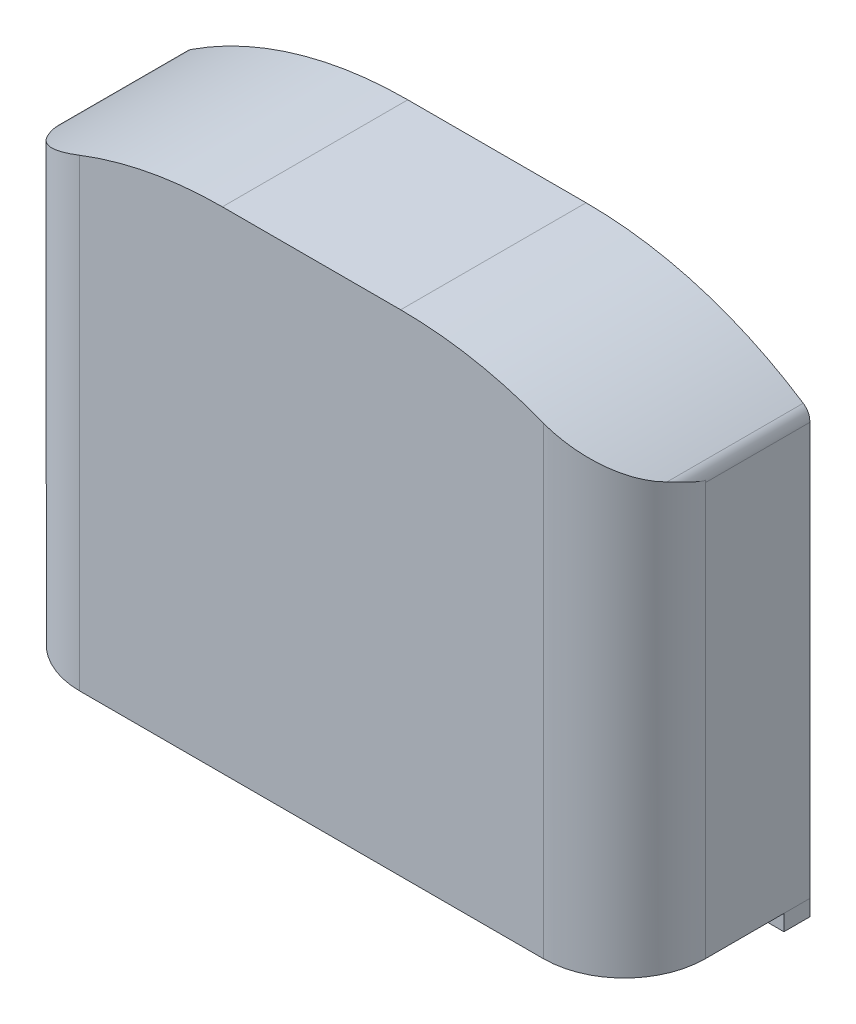
from build123d import *
from build123d.topology import SkipClean

# Parameters (mm, degrees)
SKETCH1_R              = 1.25
BOSS_EXTRUDE1_DEPTH    = 5
SKETCH1_3_R            = 2
SKETCH1_3_R_2          = 1.25
BOSS_EXTRUDE2_DEPTH    = 9
DRAFT2_ANGLE           = 1
DRAFT3_ANGLE           = 10
DRAFT4_ANGLE           = 10
DRAFT5_ANGLE           = 10
DRAFT6_ANGLE           = 10
BOSS_EXTRUDE3_START    = -47
BOSS_EXTRUDE3_DEPTH    = 65
BOSS_EXTRUDE4_DEPTH    = 18
CUT_EXTRUDE1_START     = -4
CUT_EXTRUDE1_OUTLINE_R = 1.25
CUT_EXTRUDE1_DEPTH     = 4
BOSS_EXTRUDE5_START    = -61.5
SKETCH4_3_R            = 2
SKETCH4_3_R_2          = 1.25
BOSS_EXTRUDE5_DEPTH    = 3
DRAFT7_ANGLE           = 10
BOSS_EXTRUDE6_START    = -129.207717715
BOSS_EXTRUDE6_DEPTH    = 129.207717715
BOSS_EXTRUDE7_DEPTH    = 5
BOSS_EXTRUDE8_START    = -8.1
BOSS_EXTRUDE8_DEPTH    = 8.1
BOSS_EXTRUDE9_DEPTH    = 56
CUT_EXTRUDE2_DEPTH     = 56
BOSS_EXTRUDE10_REACH   = 977.486
BOSS_EXTRUDE11_START   = 3.1
SKETCH15_R             = 1.25
BOSS_EXTRUDE11_DEPTH   = 3.1
SKETCH16_W             = 46.582234477
SKETCH16_H             = 8.626339718
BOSS_EXTRUDE12_DEPTH   = 11
CUT_EXTRUDE3_DEPTH     = 23
BOSS_EXTRUDE13_REACH   = 977.486
CUT_EXTRUDE4_START     = 902.404614716
CUT_EXTRUDE4_DEPTH     = 3
SKETCH20_R             = 10.068355609
CUT_EXTRUDE5_DEPTH     = 8.1


# Read off the part's stored shape, not the designer's step: Cut-Extrude1, Boss-Extrude6, Cut-Extrude4
with BuildPart() as part:
    # Sketch1 → Boss-Extrude1 (new body)
    with BuildSketch(Plane.XY.offset(905.504614716)):
        with BuildLine():
            Line((21.161363812, 82.735268637), (-34.714540797, 82.735268637))
            ThreePointArc((-34.714540797, 82.735268637), (-68.804835079, 77.739415811), (-100.028178471, 63.172002275))
            Line((-100.028178471, 63.172002275), (-100.028178471, -66.035715441))
            Line((-100.028178471, -66.035715441), (86.475001486, -66.035715441))
            Line((86.475001486, -66.035715441), (86.475001486, 63.172002275))
            ThreePointArc((86.475001486, 63.172002275), (55.251658094, 77.739415811), (21.161363812, 82.735268637))
        make_face()
        with Locations((-65.145436721, 57.131533665)):
            Circle(SKETCH1_R, mode=Mode.SUBTRACT)
        with Locations((-7.145436721, 57.131533665)):
            Circle(SKETCH1_R, mode=Mode.SUBTRACT)
        with Locations((-7.145436721, 8.131533665)):
            Circle(SKETCH1_R, mode=Mode.SUBTRACT)
        with Locations((-65.145436721, 8.131533665)):
            Circle(SKETCH1_R, mode=Mode.SUBTRACT)
    extrude(amount=BOSS_EXTRUDE1_DEPTH)

    # Sketch1<3> → Boss-Extrude2 (add)
    # profile 1 of 4: a face of its own
    with BuildSketch(Plane.XY.offset(905.504614716)):
        with Locations((-65.145436721, 57.131533665)):
            Circle(SKETCH1_3_R)
        with Locations((-65.145436721, 57.131533665)):
            Circle(SKETCH1_3_R_2, mode=Mode.SUBTRACT)
    # profile 2 of 4: a face of its own
    with BuildSketch(Plane.XY.offset(905.504614716)):
        with Locations((-7.145436721, 57.131533665)):
            Circle(SKETCH1_3_R)
        with Locations((-7.145436721, 57.131533665)):
            Circle(SKETCH1_3_R_2, mode=Mode.SUBTRACT)
    # profile 3 of 4: a face of its own
    with BuildSketch(Plane.XY.offset(905.504614716)):
        with Locations((-7.145436721, 8.131533665)):
            Circle(SKETCH1_3_R)
        with Locations((-7.145436721, 8.131533665)):
            Circle(SKETCH1_3_R_2, mode=Mode.SUBTRACT)
    # profile 4 of 4: a face of its own
    with BuildSketch(Plane.XY.offset(905.504614716)):
        with Locations((-65.145436721, 8.131533665)):
            Circle(SKETCH1_3_R)
        with Locations((-65.145436721, 8.131533665)):
            Circle(SKETCH1_3_R_2, mode=Mode.SUBTRACT)
    extrude(amount=BOSS_EXTRUDE2_DEPTH)

    # Draft2
    draft2_faces = [part.faces().sort_by_distance(p)[0] for p in [
        (-9.145436721, 57.131533665, 912.504614716),
    ]]
    draft(draft2_faces, Plane.XY.offset(914.504614716), DRAFT2_ANGLE)

    # Draft3
    draft3_faces = [part.faces().sort_by_distance(p)[0] for p in [
        (-9.180346851, 57.131533665, 912.504614716),
    ]]
    draft(draft3_faces, Plane.XY.offset(914.504614716), DRAFT3_ANGLE)

    # Draft4
    draft4_faces = [part.faces().sort_by_distance(p)[0] for p in [
        (-9.145436721, 8.131533665, 912.504614716),
    ]]
    draft(draft4_faces, Plane.XY.offset(914.504614716), DRAFT4_ANGLE)

    # Draft5
    draft5_faces = [part.faces().sort_by_distance(p)[0] for p in [
        (-67.145436721, 8.131533665, 912.504614716),
    ]]
    draft(draft5_faces, Plane.XY.offset(914.504614716), DRAFT5_ANGLE)

    # Draft6
    draft6_faces = [part.faces().sort_by_distance(p)[0] for p in [
        (-67.145436721, 57.131533665, 912.504614716),
    ]]
    draft(draft6_faces, Plane.XY.offset(914.504614716), DRAFT6_ANGLE)

    # Sketch2 → Boss-Extrude3 (add)
    with BuildSketch(Plane.ZY.offset(57.488178471).offset(BOSS_EXTRUDE3_START)):
        with BuildLine():
            Line((910.504614716, 1.031533665), (910.504614716, -3.968466335))
            Line((910.504614716, -3.968466335), (949.004614716, -3.968466335))
            Line((949.004614716, -3.968466335), (949.004614716, -52.468466335))
            Line((949.004614716, -52.468466335), (910.504614716, -52.468466335))
            Line((910.504614716, -52.468466335), (910.504614716, -57.468466335))
            Line((910.504614716, -57.468466335), (949.004614716, -57.468466335))
            ThreePointArc((949.004614716, -57.468466335), (952.540148622, -56.004000241), (954.004614716, -52.468466335))
            Line((954.004614716, -52.468466335), (954.004614716, 1.031533665))
            Line((954.004614716, 1.031533665), (910.504614716, 1.031533665))
        make_face()
    boss_extrude3 = extrude(amount=BOSS_EXTRUDE3_DEPTH)

    # Mirror1: Boss-Extrude3 across plane
    add(boss_extrude3.mirror(Plane.ZY.offset(6.776588492)))

    # Sketch3 → Boss-Extrude4 (add)
    with BuildSketch(Plane(origin=(61.935001486, 0, 0), x_dir=(0, 0, -1), z_dir=(1, 0, 0))):
        with BuildLine():
            Line((-948.618181428, 8.159490613), (-948.618181428, 1.031533665))
            Line((-948.618181428, 1.031533665), (-945.118181428, 1.031533665))
            Line((-945.118181428, 1.031533665), (-945.118181428, 6.659490613))
            Line((-945.118181428, 6.659490613), (-932.117085954, 6.659490613))
            Line((-932.117085954, 6.659490613), (-932.117085954, 4.976311178))
            Line((-932.117085954, 4.976311178), (-929.820703495, 4.976311178))
            Line((-929.820703495, 4.976311178), (-929.820703495, 6.659490613))
            Line((-929.820703495, 6.659490613), (-929.820703495, 10.159490613))
            Line((-929.820703495, 10.159490613), (-946.618181428, 10.159490613))
            ThreePointArc((-946.618181428, 10.159490613), (-948.032394991, 9.573704175), (-948.618181428, 8.159490613))
        make_face()
    extrude(amount=-BOSS_EXTRUDE4_DEPTH)

    # Cut-Extrude1 outline → Cut-Extrude1 (cut)
    with BuildSketch(Plane.XZ.offset(57.468466335).offset(CUT_EXTRUDE1_START)):
        with BuildLine():
            Line((-70.665918987, 949.004614716), (-68.166437954, 949.004614716))
            ThreePointArc((-68.166437954, 949.004614716), (-69.416178471, 950.280083156), (-70.665918987, 949.004614716))
        make_face()
        with BuildLine():
            Line((-14.785918987, 949.004614716), (-12.286437954, 949.004614716))
            ThreePointArc((-12.286437954, 949.004614716), (-13.536178471, 950.280083156), (-14.785918987, 949.004614716))
        make_face()
        with Locations((-69.416178471, 929.980083156)):
            Circle(CUT_EXTRUDE1_OUTLINE_R)
        with Locations((-13.536178471, 929.980083156)):
            Circle(CUT_EXTRUDE1_OUTLINE_R)
    extrude(amount=CUT_EXTRUDE1_DEPTH, mode=Mode.SUBTRACT)

    # Sketch4<3> → Boss-Extrude5 (add)
    # profile 1 of 4: a face of its own
    with BuildSketch(Plane.XZ.offset(57.468466335).offset(BOSS_EXTRUDE5_START)):
        with Locations((-69.416178471, 949.030083156)):
            Circle(SKETCH4_3_R)
        with Locations((-69.416178471, 949.030083156)):
            Circle(SKETCH4_3_R_2, mode=Mode.SUBTRACT)
    # profile 2 of 4: a face of its own
    with BuildSketch(Plane.XZ.offset(57.468466335).offset(BOSS_EXTRUDE5_START)):
        with Locations((-69.416178471, 929.980083156)):
            Circle(SKETCH4_3_R)
        with Locations((-69.416178471, 929.980083156)):
            Circle(SKETCH4_3_R_2, mode=Mode.SUBTRACT)
    # profile 3 of 4: a face of its own
    with BuildSketch(Plane.XZ.offset(57.468466335).offset(BOSS_EXTRUDE5_START)):
        with Locations((-13.536178471, 929.980083156)):
            Circle(SKETCH4_3_R)
        with Locations((-13.536178471, 929.980083156)):
            Circle(SKETCH4_3_R_2, mode=Mode.SUBTRACT)
    # profile 4 of 4: a face of its own
    with BuildSketch(Plane.XZ.offset(57.468466335).offset(BOSS_EXTRUDE5_START)):
        with Locations((-13.536178471, 949.030083156)):
            Circle(SKETCH4_3_R)
        with Locations((-13.536178471, 949.030083156)):
            Circle(SKETCH4_3_R_2, mode=Mode.SUBTRACT)
    extrude(amount=BOSS_EXTRUDE5_DEPTH)

    # Draft7
    draft7_faces = [part.faces().sort_by_distance(p)[0] for p in [
        (-71.416178471, 2.531533665, 929.980083156),
        (-15.536178471, 2.531533665, 929.980083156),
        (-15.536178471, 2.531533665, 949.030083156),
        (-71.416178471, 2.531533665, 949.030083156),
    ]]
    draft(draft7_faces, Plane(origin=(-69.416178471, 4.031533665, 949.030083156), x_dir=(1, 0, 0), z_dir=(0, 1, 0)), DRAFT7_ANGLE)

    # Sketch6 → Boss-Extrude7 (add)
    with BuildSketch(Plane.XZ.offset(66.035715441)):
        Polygon((-100.028178471, 910.504614716), (-104.828178471, 910.504614716), (-104.828178471, 902.404614716), (91.275001486, 902.404614716), (91.275001486, 910.504614716), align=None)
    extrude(amount=BOSS_EXTRUDE7_DEPTH)

    # Sketch15 → Boss-Extrude11 (add)
    with SkipClean():  # the faces are left unmerged after this step: merging them gives an invalid solid
        with BuildSketch(Plane(origin=(0, 0, 905.504614716), x_dir=(-1, 0, 0), z_dir=(0, 0, -1)).offset(BOSS_EXTRUDE11_START)):
            with BuildLine():
                Line((-83.275001486, 65.205496764), (-83.275001486, 63.172002275))
                Line((-83.275001486, 63.172002275), (-83.275001486, -66.035715441))
                Line((-83.275001486, -66.035715441), (96.828178471, -66.035715441))
                Line((96.828178471, -66.035715441), (96.828178471, 63.172002275))
                Line((96.828178471, 63.172002275), (96.828178471, 65.205496764))
                ThreePointArc((96.828178471, 65.205496764), (66.984483805, 78.26887305), (34.714540797, 82.735268637))
                Line((34.714540797, 82.735268637), (-21.161363812, 82.735268637))
                ThreePointArc((-21.161363812, 82.735268637), (-53.43130682, 78.26887305), (-83.275001486, 65.205496764))
            make_face()
            with Locations((7.145436721, 8.131533665)):
                Circle(SKETCH15_R, mode=Mode.SUBTRACT)
            with Locations((65.145436721, 8.131533665)):
                Circle(SKETCH15_R, mode=Mode.SUBTRACT)
            with Locations((7.145436721, 57.131533665)):
                Circle(SKETCH15_R, mode=Mode.SUBTRACT)
            with Locations((65.145436721, 57.131533665)):
                Circle(SKETCH15_R, mode=Mode.SUBTRACT)
        extrude(amount=-BOSS_EXTRUDE11_DEPTH)

    # Sketch16 → Boss-Extrude12 (add)
    with SkipClean():  # the faces are left unmerged after this step: merging them gives an invalid solid
        with BuildSketch(Plane(origin=(0, 0, 902.404614716), x_dir=(-1, 0, 0), z_dir=(0, 0, -1))):
            with Locations((6.776588493, 36.174406639)):
                Rectangle(SKETCH16_W, SKETCH16_H)
        extrude(amount=BOSS_EXTRUDE12_DEPTH)

    # Sketch17 → Cut-Extrude3 (cut)
    with SkipClean():  # the faces are left unmerged after this step: merging them gives an invalid solid
        with BuildSketch(Plane(origin=(0, 40.487576498, 0), x_dir=(1, 0, 0), z_dir=(0, 1, 0))):
            with BuildLine():
                Line((-20.276588492, -894.404614716), (6.723411508, -894.404614716))
                ThreePointArc((6.723411508, -894.404614716), (8.973411508, -896.654614716), (6.723411508, -898.904614716))
                Line((6.723411508, -898.904614716), (-20.276588492, -898.904614716))
                ThreePointArc((-20.276588492, -898.904614716), (-22.526588492, -896.654614716), (-20.276588492, -894.404614716))
            make_face()
        extrude(amount=-CUT_EXTRUDE3_DEPTH, mode=Mode.SUBTRACT)

    # Cut-Extrude4 outline → Cut-Extrude4 (cut)
    with SkipClean():  # the faces are left unmerged after this step: merging them gives an invalid solid
        with BuildSketch(Plane.XY.offset(CUT_EXTRUDE4_START)):
            with BuildLine():
                ThreePointArc((83.275001486, 65.205496765), (83.02518939, 65.358280617), (82.775001486, 65.510448293))
                Line((82.775001486, 65.510448293), (82.775001486, -66.035715441))
                Line((82.775001486, -66.035715441), (83.275001486, -66.035715441))
                Line((83.275001486, -66.035715441), (83.275001486, 65.205496765))
            make_face()
            with BuildLine():
                Line((-96.828178471, -66.035715441), (-96.328178471, -66.035715441))
                Line((-96.328178471, -66.035715441), (-96.328178471, 65.510448293))
                ThreePointArc((-96.328178471, 65.510448293), (-96.578366375, 65.358280617), (-96.828178471, 65.205496765))
                Line((-96.828178471, 65.205496765), (-96.828178471, -66.035715441))
            make_face()
        extrude(amount=CUT_EXTRUDE4_DEPTH, mode=Mode.SUBTRACT)

    # Sketch20 → Cut-Extrude5 (cut)
    with BuildSketch(Plane(origin=(0, 0, 902.404614716), x_dir=(-1, 0, 0), z_dir=(0, 0, -1))):
        with Locations((-66.306295987, 50.017245785)):
            Circle(SKETCH20_R)
    extrude(amount=-CUT_EXTRUDE5_DEPTH, mode=Mode.SUBTRACT)


with BuildPart() as body_2:
    # Boss-Extrude6 outline → Boss-Extrude6 (new body)
    with BuildSketch(Plane.XZ.offset(66.035715441).offset(BOSS_EXTRUDE6_START)):
        with BuildLine():
            Line((91.275001486, 902.404614716), (91.275001486, 935.145243266))
            ThreePointArc((91.275001486, 935.145243266), (83.847413555, 953.077026785), (65.915630036, 960.504614716))
            Line((65.915630036, 960.504614716), (-79.468807021, 960.504614716))
            ThreePointArc((-79.468807021, 960.504614716), (-97.40059054, 953.077026785), (-104.828178471, 935.145243266))
            Line((-104.828178471, 935.145243266), (-104.828178471, 902.404614716))
            Line((-104.828178471, 902.404614716), (-96.828178471, 902.404614716))
            Line((-96.828178471, 902.404614716), (-96.828178471, 905.404614716))
            Line((-96.828178471, 905.404614716), (-99.828178471, 905.404614716))
            Line((-99.828178471, 905.404614716), (-99.828178471, 905.504614716))
            Line((-99.828178471, 905.504614716), (-100.028178471, 905.504614716))
            Line((-100.028178471, 905.504614716), (-100.028178471, 910.504614716))
            Line((-100.028178471, 910.504614716), (-99.828178471, 910.504614716))
            Line((-99.828178471, 910.504614716), (-99.828178471, 910.604614716))
            Line((-99.828178471, 910.604614716), (-96.828178471, 910.604614716))
            Line((-96.828178471, 910.604614716), (-96.828178471, 925.760622686))
            Line((-96.828178471, 925.760622686), (-99.828178471, 925.760622686))
            Line((-99.828178471, 925.760622686), (-99.828178471, 935.145243266))
            ThreePointArc((-99.828178471, 935.145243266), (-93.865056634, 949.541492879), (-79.468807021, 955.504614716))
            Line((-79.468807021, 955.504614716), (65.915630036, 955.504614716))
            ThreePointArc((65.915630036, 955.504614716), (80.311879649, 949.541492879), (86.275001486, 935.145243266))
            Line((86.275001486, 935.145243266), (86.275001486, 925.760622686))
            Line((86.275001486, 925.760622686), (83.275001486, 925.760622686))
            Line((83.275001486, 925.760622686), (83.275001486, 910.604614716))
            Line((83.275001486, 910.604614716), (86.275001486, 910.604614716))
            Line((86.275001486, 910.604614716), (86.275001486, 910.504614716))
            Line((86.275001486, 910.504614716), (86.475001486, 910.504614716))
            Line((86.475001486, 910.504614716), (86.475001486, 905.504614716))
            Line((86.475001486, 905.504614716), (86.275001486, 905.504614716))
            Line((86.275001486, 905.504614716), (86.275001486, 905.404614716))
            Line((86.275001486, 905.404614716), (83.275001486, 905.404614716))
            Line((83.275001486, 905.404614716), (83.275001486, 902.404614716))
            Line((83.275001486, 902.404614716), (91.275001486, 902.404614716))
        make_face()
    extrude(amount=BOSS_EXTRUDE6_DEPTH)

    # Sketch7 → Boss-Extrude8 (add)
    with BuildSketch(Plane.XY.offset(910.504614716).offset(BOSS_EXTRUDE8_START)):
        with BuildLine():
            Line((21.161363812, 87.735268637), (-34.714540797, 87.735268637))
            ThreePointArc((-34.714540797, 87.735268637), (-70.239500486, 82.529168954), (-102.776855727, 67.348696343))
            ThreePointArc((-102.776855727, 67.348696343), (-104.371745258, 65.539917467), (-104.828178471, 63.172002275))
            Line((-104.828178471, 63.172002275), (-100.028178471, 63.172002275))
            ThreePointArc((-100.028178471, 63.172002275), (-68.804835079, 77.739415811), (-34.714540797, 82.735268637))
            Line((-34.714540797, 82.735268637), (21.161363812, 82.735268637))
            ThreePointArc((21.161363812, 82.735268637), (55.251658094, 77.739415811), (86.475001486, 63.172002275))
            Line((86.475001486, 63.172002275), (91.275001486, 63.172002275))
            ThreePointArc((91.275001486, 63.172002275), (90.818568273, 65.539917467), (89.223678742, 67.348696343))
            ThreePointArc((89.223678742, 67.348696343), (56.686323501, 82.529168954), (21.161363812, 87.735268637))
        make_face()
    extrude(amount=BOSS_EXTRUDE8_DEPTH)

    # Sketch7<2> → Boss-Extrude9 (add)
    with BuildSketch(Plane.XY.offset(910.504614716)):
        with BuildLine():
            Line((21.161363812, 87.735268637), (-34.714540797, 87.735268637))
            ThreePointArc((-34.714540797, 87.735268637), (-70.239500486, 82.529168954), (-102.776855727, 67.348696343))
            ThreePointArc((-102.776855727, 67.348696343), (-104.371745258, 65.539917467), (-104.828178471, 63.172002275))
            Line((-104.828178471, 63.172002275), (-100.028178471, 63.172002275))
            ThreePointArc((-100.028178471, 63.172002275), (-68.804835079, 77.739415811), (-34.714540797, 82.735268637))
            Line((-34.714540797, 82.735268637), (21.161363812, 82.735268637))
            ThreePointArc((21.161363812, 82.735268637), (55.251658094, 77.739415811), (86.475001486, 63.172002275))
            Line((86.475001486, 63.172002275), (91.275001486, 63.172002275))
            ThreePointArc((91.275001486, 63.172002275), (90.818568273, 65.539917467), (89.223678742, 67.348696343))
            ThreePointArc((89.223678742, 67.348696343), (56.686323501, 82.529168954), (21.161363812, 87.735268637))
        make_face()
    extrude(amount=BOSS_EXTRUDE9_DEPTH)

    # Sketch10 → Cut-Extrude2 (cut)
    with BuildSketch(Plane.XZ.offset(-63.172002275)):
        with BuildLine():
            Line((-79.468807021, 960.504614716), (65.915630036, 960.504614716))
            ThreePointArc((65.915630036, 960.504614716), (83.847413555, 953.077026785), (91.275001486, 935.145243266))
            Line((91.275001486, 935.145243266), (92.520700436, 922.961616698))
            Line((92.520700436, 922.961616698), (122.961907159, 979.440815325))
            Line((122.961907159, 979.440815325), (-128.30764443, 995.795076958))
            Line((-128.30764443, 995.795076958), (-157.73230749, 853.196956064))
            Line((-157.73230749, 853.196956064), (-104.828178471, 935.145243266))
            ThreePointArc((-104.828178471, 935.145243266), (-97.40059054, 953.077026785), (-79.468807021, 960.504614716))
        make_face()
    extrude(amount=-CUT_EXTRUDE2_DEPTH, mode=Mode.SUBTRACT)

    # Sketch13 → Boss-Extrude10 (add, up to next)
    with BuildSketch(Plane(origin=(0, 63.172002275, 0), x_dir=(1, 0, 0), z_dir=(0, 1, 0)), mode=Mode.PRIVATE) as boss_extrude10_sk1:
        with BuildLine():
            Line((-79.468807021, -960.504614716), (65.915630036, -960.504614716))
            ThreePointArc((65.915630036, -960.504614716), (77.461346859, -957.723864645), (86.475001486, -949.991453756))
            Line((86.475001486, -949.991453756), (86.475001486, -910.504614716))
            Line((86.475001486, -910.504614716), (86.275001486, -910.504614716))
            Line((86.275001486, -910.504614716), (86.275001486, -910.604614716))
            Line((86.275001486, -910.604614716), (83.275001486, -910.604614716))
            Line((83.275001486, -910.604614716), (83.275001486, -925.760622686))
            Line((83.275001486, -925.760622686), (86.275001486, -925.760622686))
            Line((86.275001486, -925.760622686), (86.275001486, -935.145243266))
            ThreePointArc((86.275001486, -935.145243266), (80.311879649, -949.541492879), (65.915630036, -955.504614716))
            Line((65.915630036, -955.504614716), (-79.468807021, -955.504614716))
            ThreePointArc((-79.468807021, -955.504614716), (-93.865056634, -949.541492879), (-99.828178471, -935.145243266))
            Line((-99.828178471, -935.145243266), (-99.828178471, -925.760622686))
            Line((-99.828178471, -925.760622686), (-96.828178471, -925.760622686))
            Line((-96.828178471, -925.760622686), (-96.828178471, -910.604614716))
            Line((-96.828178471, -910.604614716), (-99.828178471, -910.604614716))
            Line((-99.828178471, -910.604614716), (-99.828178471, -910.504614716))
            Line((-99.828178471, -910.504614716), (-100.028178471, -910.504614716))
            Line((-100.028178471, -910.504614716), (-100.028178471, -949.991453756))
            ThreePointArc((-100.028178471, -949.991453756), (-91.014523843, -957.723864645), (-79.468807021, -960.504614716))
        make_face()
    boss_extrude10_tool1 = extrude(boss_extrude10_sk1.sketch, amount=BOSS_EXTRUDE10_REACH, mode=Mode.PRIVATE) - body_2.part
    add(boss_extrude10_tool1.solids().sort_by_distance((-90.13542, 63.172002, 956.004702))[0])

    # Sketch18 → Boss-Extrude13 (add, up to next)
    with BuildSketch(Plane(origin=(0, 63.172002275, 0), x_dir=(1, 0, 0), z_dir=(0, 1, 0)), mode=Mode.PRIVATE) as boss_extrude13_sk1:
        Polygon((86.275001486, -905.504614716), (86.475001486, -905.504614716), (86.475001486, -902.404614716), (83.275001486, -902.404614716), (83.275001486, -905.404614716), (86.275001486, -905.404614716), align=None)
    boss_extrude13_tool1 = extrude(boss_extrude13_sk1.sketch, amount=BOSS_EXTRUDE13_REACH, mode=Mode.PRIVATE) - body_2.part
    # Sketch18 → Boss-Extrude13 (add, up to next)
    with BuildSketch(Plane(origin=(0, 63.172002275, 0), x_dir=(1, 0, 0), z_dir=(0, 1, 0)), mode=Mode.PRIVATE) as boss_extrude13_sk2:
        Polygon((-96.828178471, -902.404614716), (-100.028178471, -902.404614716), (-100.028178471, -905.504614716), (-99.828178471, -905.504614716), (-99.828178471, -905.404614716), (-96.828178471, -905.404614716), align=None)
    boss_extrude13_tool2 = extrude(boss_extrude13_sk2.sketch, amount=BOSS_EXTRUDE13_REACH, mode=Mode.PRIVATE) - body_2.part
    add(boss_extrude13_tool1.solids().sort_by_distance((84.87812, 63.172002, 903.907837))[0])
    add(boss_extrude13_tool2.solids().sort_by_distance((-98.431297, 63.172002, 903.907837))[0])


solid = Compound([part.part, body_2.part])
